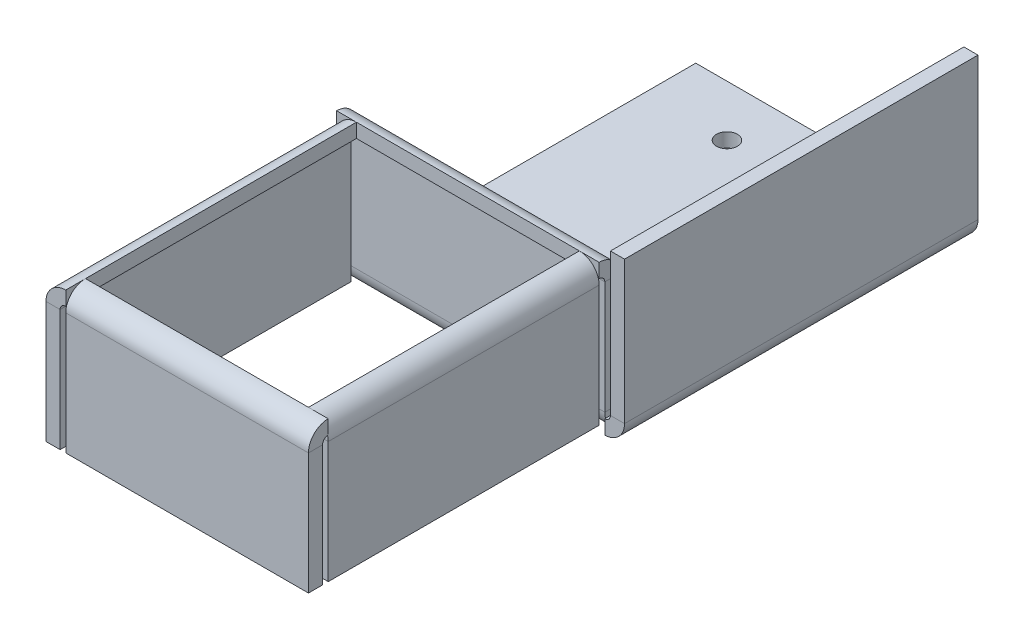
from build123d import *

# Parameters (mm, degrees)
BASE_FLANGE1_OUTLINE_W       = 50
BASE_FLANGE1_OUTLINE_H       = 62.620541263
BASE_FLANGE1_OUTLINE_R       = 1.849849123
BASE_FLANGE1_DEPTH           = 2.5
EDGE_FLANGE1_STRIP_W         = 12
EDGE_FLANGE1_STRIP_H         = 2.5
EDGE_FLANGE1_STRIP_CUT_DEPTH = 62.620541263
EDGE_FLANGE1_DEPTH           = 62.620541263
EDGE_FLANGE2_STRIP_W         = 12
EDGE_FLANGE2_STRIP_H         = 2.5
EDGE_FLANGE2_STRIP_CUT_DEPTH = 46.5
EDGE_FLANGE2_DEPTH           = 46.5
EDGE_FLANGE4_STRIP_W         = 12
EDGE_FLANGE4_STRIP_H         = 2.5
EDGE_FLANGE4_STRIP_CUT_DEPTH = 46.5
EDGE_FLANGE4_DEPTH           = 46.5
EDGE_FLANGE5_STRIP_W         = 12
EDGE_FLANGE5_STRIP_H         = 2.5
EDGE_FLANGE5_STRIP_CUT_DEPTH = 51.5
EDGE_FLANGE5_DEPTH           = 51.5
EDGE_FLANGE6_STRIP_W         = 12
EDGE_FLANGE6_STRIP_H         = 2.5
EDGE_FLANGE6_STRIP_CUT_DEPTH = 43
EDGE_FLANGE6_DEPTH           = 43
EDGE_FLANGE7_STRIP_W         = 12
EDGE_FLANGE7_STRIP_H         = 2.5
EDGE_FLANGE7_STRIP_CUT_DEPTH = 48
EDGE_FLANGE7_DEPTH           = 48
SKETCH31_W                   = 39.5
SKETCH31_H                   = 48
CUT_EXTRUDE1_DEPTH           = 4


# Read off the part's stored shape, not the designer's step: Base-Flange1
# Sheet-metal steps are written as plain solids
with BuildPart() as part:
    # Base-Flange1 outline → Base-Flange1 (new body)
    with BuildSketch(Plane(origin=(0, 280, 0), x_dir=(1, 0, 0), z_dir=(0, 1, 0))):
        with Locations((275, 81.310270632)):
            Rectangle(BASE_FLANGE1_OUTLINE_W, BASE_FLANGE1_OUTLINE_H)
        with Locations((264.597334147, 103.542995429)):
            Circle(BASE_FLANGE1_OUTLINE_R, mode=Mode.SUBTRACT)
        with Locations((285.402665853, 103.542995429)):
            Circle(BASE_FLANGE1_OUTLINE_R, mode=Mode.SUBTRACT)
    extrude(amount=BASE_FLANGE1_DEPTH)

    # Edge-Flange1 strip (across the edge) → Edge-Flange1 strip cut (cut)
    with BuildSketch(Plane(origin=(300, 282.5, -50), x_dir=(-1, 0, 0), z_dir=(0, 0, -1))):
        with Locations((-2.5, -1.25)):
            Rectangle(EDGE_FLANGE1_STRIP_W, EDGE_FLANGE1_STRIP_H)
    extrude(amount=EDGE_FLANGE1_STRIP_CUT_DEPTH, mode=Mode.SUBTRACT)

    # Edge-Flange1 section (across the edge) → Edge-Flange1 (add)
    with BuildSketch(Plane(origin=(300, 282.5, -50), x_dir=(-1, 0, 0), z_dir=(0, 0, -1))):
        with BuildLine():
            Line((0, 1), (0, 26.2366))
            Line((0, 26.2366), (2.5, 26.2366))
            Line((2.5, 26.2366), (2.5, 1))
            ThreePointArc((2.5, 1), (2.792893219, 0.292893219), (3.5, 0))
            Line((3.5, 0), (3.5, -2.5))
            ThreePointArc((3.5, -2.5), (1.025126266, -1.474873734), (0, 1))
        make_face()
    extrude(amount=EDGE_FLANGE1_DEPTH)

    # Edge-Flange2 strip (across the edge) → Edge-Flange2 strip cut (cut)
    with BuildSketch(Plane(origin=(250, 282.5, -50), x_dir=(0, 0, -1), z_dir=(1, 0, 0))):
        with Locations((-2.5, -1.25)):
            Rectangle(EDGE_FLANGE2_STRIP_W, EDGE_FLANGE2_STRIP_H)
    extrude(amount=EDGE_FLANGE2_STRIP_CUT_DEPTH, mode=Mode.SUBTRACT)

    # Edge-Flange2 section (across the edge) → Edge-Flange2 (add)
    with BuildSketch(Plane(origin=(250, 282.5, -50), x_dir=(0, 0, -1), z_dir=(1, 0, 0))):
        with BuildLine():
            Line((0, 1), (0, 24.5))
            Line((0, 24.5), (2.5, 24.5))
            Line((2.5, 24.5), (2.5, 1))
            ThreePointArc((2.5, 1), (2.792893219, 0.292893219), (3.5, 0))
            Line((3.5, 0), (3.5, -2.5))
            ThreePointArc((3.5, -2.5), (1.025126266, -1.474873734), (0, 1))
        make_face()
    extrude(amount=EDGE_FLANGE2_DEPTH)

    # Edge-Flange4 strip (across the edge) → Edge-Flange4 strip cut (cut)
    with BuildSketch(Plane(origin=(296.5, 307, -50), x_dir=(0, -1, 0), z_dir=(-1, 0, 0))):
        with Locations((-2.5, -1.25)):
            Rectangle(EDGE_FLANGE4_STRIP_W, EDGE_FLANGE4_STRIP_H)
    extrude(amount=EDGE_FLANGE4_STRIP_CUT_DEPTH, mode=Mode.SUBTRACT)

    # Edge-Flange4 section (across the edge) → Edge-Flange4 (add)
    with BuildSketch(Plane(origin=(296.5, 307, -50), x_dir=(0, -1, 0), z_dir=(-1, 0, 0))):
        with BuildLine():
            Line((0, 1), (0, 52.5))
            Line((0, 52.5), (2.5, 52.5))
            Line((2.5, 52.5), (2.5, 1))
            ThreePointArc((2.5, 1), (2.792893219, 0.292893219), (3.5, 0))
            Line((3.5, 0), (3.5, -2.5))
            ThreePointArc((3.5, -2.5), (1.025126266, -1.474873734), (0, 1))
        make_face()
    extrude(amount=EDGE_FLANGE4_DEPTH)

    # Edge-Flange5 strip (across the edge) → Edge-Flange5 strip cut (cut)
    with BuildSketch(Plane(origin=(250, 304.5, 2.5), x_dir=(1, 0, 0), z_dir=(0, 0, -1))):
        with Locations((-2.5, -1.25)):
            Rectangle(EDGE_FLANGE5_STRIP_W, EDGE_FLANGE5_STRIP_H)
    extrude(amount=EDGE_FLANGE5_STRIP_CUT_DEPTH, mode=Mode.SUBTRACT)

    # Edge-Flange5 section (across the edge) → Edge-Flange5 (add)
    with BuildSketch(Plane(origin=(250, 304.5, 2.5), x_dir=(1, 0, 0), z_dir=(0, 0, -1))):
        with BuildLine():
            Line((0, 1), (0, 22.5))
            Line((0, 22.5), (2.5, 22.5))
            Line((2.5, 22.5), (2.5, 1))
            ThreePointArc((2.5, 1), (2.792893219, 0.292893219), (3.5, 0))
            Line((3.5, 0), (3.5, -2.5))
            ThreePointArc((3.5, -2.5), (1.025126266, -1.474873734), (0, 1))
        make_face()
    extrude(amount=EDGE_FLANGE5_DEPTH)

    # Edge-Flange6 strip (across the edge) → Edge-Flange6 strip cut (cut)
    with BuildSketch(Plane(origin=(296.5, 304.5, 2.5), x_dir=(0, 0, -1), z_dir=(-1, 0, 0))):
        with Locations((-2.5, -1.25)):
            Rectangle(EDGE_FLANGE6_STRIP_W, EDGE_FLANGE6_STRIP_H)
    extrude(amount=EDGE_FLANGE6_STRIP_CUT_DEPTH, mode=Mode.SUBTRACT)

    # Edge-Flange6 section (across the edge) → Edge-Flange6 (add)
    with BuildSketch(Plane(origin=(296.5, 304.5, 2.5), x_dir=(0, 0, -1), z_dir=(-1, 0, 0))):
        with BuildLine():
            Line((0, 1), (0, 22.5))
            Line((0, 22.5), (2.5, 22.5))
            Line((2.5, 22.5), (2.5, 1))
            ThreePointArc((2.5, 1), (2.792893219, 0.292893219), (3.5, 0))
            Line((3.5, 0), (3.5, -2.5))
            ThreePointArc((3.5, -2.5), (1.025126266, -1.474873734), (0, 1))
        make_face()
    extrude(amount=EDGE_FLANGE6_DEPTH)

    # Edge-Flange7 strip (across the edge) → Edge-Flange7 strip cut (cut)
    with BuildSketch(Plane(origin=(296.5, 304.5, -49), x_dir=(-1, 0, 0), z_dir=(0, 0, 1))):
        with Locations((-2.5, -1.25)):
            Rectangle(EDGE_FLANGE7_STRIP_W, EDGE_FLANGE7_STRIP_H)
    extrude(amount=EDGE_FLANGE7_STRIP_CUT_DEPTH, mode=Mode.SUBTRACT)

    # Edge-Flange7 section (across the edge) → Edge-Flange7 (add)
    with BuildSketch(Plane(origin=(296.5, 304.5, -49), x_dir=(-1, 0, 0), z_dir=(0, 0, 1))):
        with BuildLine():
            Line((0, 1), (0, 22.5))
            Line((0, 22.5), (2.5, 22.5))
            Line((2.5, 22.5), (2.5, 1))
            ThreePointArc((2.5, 1), (2.792893219, 0.292893219), (3.5, 0))
            Line((3.5, 0), (3.5, -2.5))
            ThreePointArc((3.5, -2.5), (1.025126266, -1.474873734), (0, 1))
        make_face()
    extrude(amount=EDGE_FLANGE7_DEPTH)

    # Sketch31 → Cut-Extrude1 (cut)
    with BuildSketch(Plane(origin=(0, 307, 0), x_dir=(1, 0, 0), z_dir=(0, 1, 0))):
        with Locations((273.25, 25)):
            Rectangle(SKETCH31_W, SKETCH31_H)
    extrude(amount=-CUT_EXTRUDE1_DEPTH, mode=Mode.SUBTRACT)


solid = part.part
